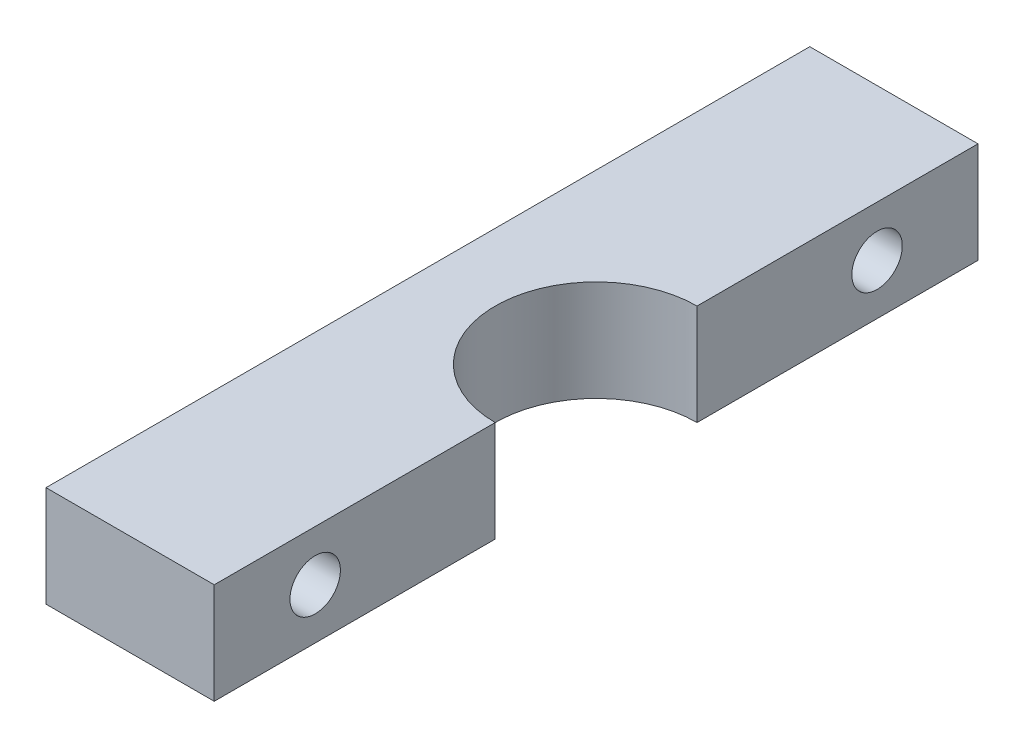
from build123d import *

# Parameters (mm, degrees)
BOSS_EXTRUDE1_DEPTH      = 6
F_3_0_3_DIAMETER_HOLE1_D = 3


with BuildPart() as part:
    # Sketch1 → Boss-Extrude1 (new body)
    with BuildSketch(Plane(origin=(0, 0, 0), x_dir=(1, 0, 0), z_dir=(0, 1, 0))):
        with BuildLine():
            Line((10, 28.7), (10, 45.4))
            Line((10, 45.4), (0, 45.4))
            Line((0, 45.4), (0, 0))
            Line((0, 0), (10, 0))
            Line((10, 0), (10, 16.7))
            ThreePointArc((10, 16.7), (4, 22.7), (10, 28.7))
        make_face()
    extrude(amount=BOSS_EXTRUDE1_DEPTH)

    # Ø3.0 (3) Diameter Hole1 (through all)
    with Locations(Plane.ZY):
        with Locations((-6, 3), (-39.4, 3)):
            Hole(F_3_0_3_DIAMETER_HOLE1_D / 2)


solid = part.part
